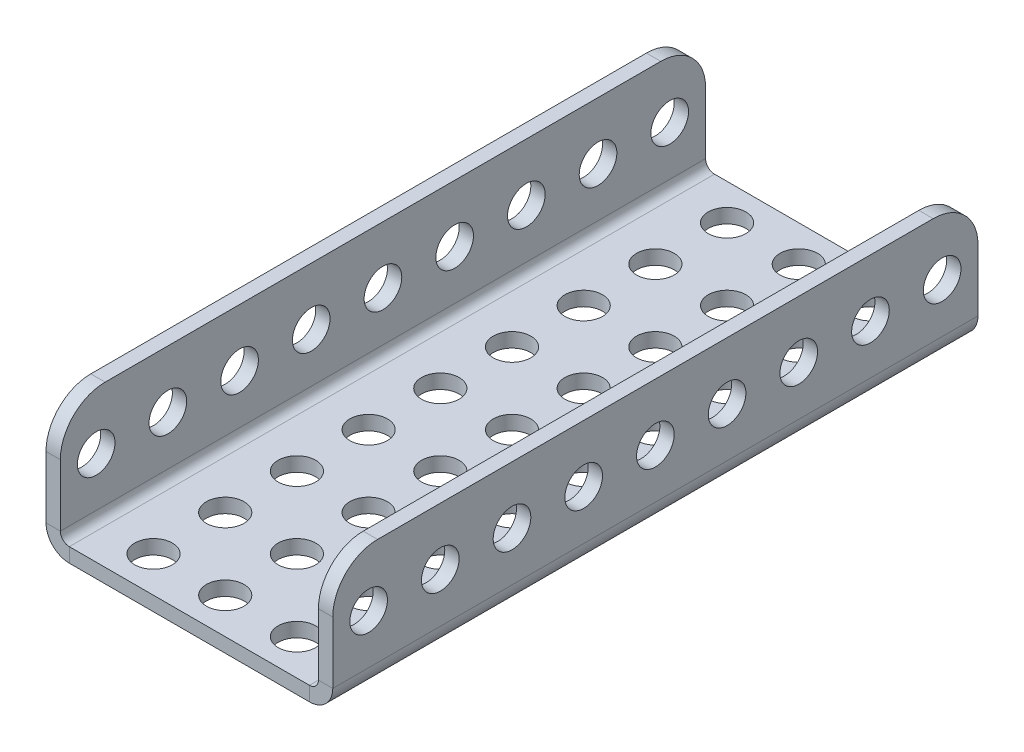
from build123d import *

# Parameters (mm, degrees)
SKETCH1_W                      = 32
SKETCH1_H                      = 72
BOSS_EXTRUDE1_DEPTH            = 1.6
SKETCH2_R                      = 2.1
CUT_EXTRUDE1_DEPTH             = 79.807106279
LPATTERN1_COUNT                = 3
LPATTERN1_PITCH                = 8
LPATTERN1_COUNT_DIR2           = 9
LPATTERN1_PITCH_DIR2           = 8
EDGE_FLANGE1_STRIP_W           = 8.4
EDGE_FLANGE1_STRIP_H           = 1.6
EDGE_FLANGE1_STRIP_CUT_DEPTH   = 72
EDGE_FLANGE1_STRIP_2_W         = 8.4
EDGE_FLANGE1_STRIP_2_H         = 1.6
EDGE_FLANGE1_STRIP_CUT_2_DEPTH = 72
EDGE_FLANGE1_DEPTH             = 72
EDGE_FLANGE1_BEND_DEPTH        = 72
FILLET1_R                      = 5
SKETCH14_R                     = 2.1
CUT_EXTRUDE2_DEPTH             = 81.113981302
LPATTERN2_COUNT                = 9
LPATTERN2_PITCH                = 8


# Sheet-metal steps are written as plain solids
with BuildPart() as part:
    # Sketch1 → Boss-Extrude1 (new body)
    with BuildSketch(Plane(origin=(0, 0, 0), x_dir=(1, 0, 0), z_dir=(0, 1, 0))):
        with Locations((16, -36)):
            Rectangle(SKETCH1_W, SKETCH1_H)
    extrude(amount=BOSS_EXTRUDE1_DEPTH)

    # Sketch2 → Cut-Extrude1 (cut, through all)
    with BuildSketch(Plane(origin=(0, 1.6, 0), x_dir=(1, 0, 0), z_dir=(0, 1, 0))):
        with Locations(Location((8, -4, 0), (0, 0, 270))):
            Circle(SKETCH2_R)
    cut_extrude1 = extrude(amount=-CUT_EXTRUDE1_DEPTH, mode=Mode.SUBTRACT)

    # LPattern1: Cut-Extrude1 3 × 9
    with Locations(*[(i * LPATTERN1_PITCH, 0, j * LPATTERN1_PITCH_DIR2) for i in range(LPATTERN1_COUNT) for j in range(LPATTERN1_COUNT_DIR2) if (i, j) != (0, 0)]):
        add(cut_extrude1, mode=Mode.SUBTRACT)

    # Edge-Flange1 strip (across the edge) → Edge-Flange1 strip cut (cut)
    with BuildSketch(Plane(origin=(32, 1.6, 72), x_dir=(-1, 0, 0), z_dir=(0, 0, -1))):
        with Locations((-1.6, -0.8)):
            Rectangle(EDGE_FLANGE1_STRIP_W, EDGE_FLANGE1_STRIP_H)
    extrude(amount=EDGE_FLANGE1_STRIP_CUT_DEPTH, mode=Mode.SUBTRACT)

    # Edge-Flange1 strip 2 (across the edge) → Edge-Flange1 strip cut 2 (cut)
    with BuildSketch(Plane(origin=(0, 1.6, 0), x_dir=(1, 0, 0), z_dir=(0, 0, 1))):
        with Locations((-1.6, -0.8)):
            Rectangle(EDGE_FLANGE1_STRIP_2_W, EDGE_FLANGE1_STRIP_2_H)
    extrude(amount=EDGE_FLANGE1_STRIP_CUT_2_DEPTH, mode=Mode.SUBTRACT)

    # Edge-Flange1 section (across the edge) → Edge-Flange1 (add)
    with BuildSketch(Plane(origin=(32, 1.6, 72), x_dir=(-1, 0, 0), z_dir=(0, 0, -1))):
        with BuildLine():
            Line((0, 1), (0, 12.9))
            Line((0, 12.9), (1.6, 12.9))
            Line((1.6, 12.9), (1.6, 1))
            ThreePointArc((1.6, 1), (1.892893219, 0.292893219), (2.6, 0))
            Line((2.6, 0), (2.6, -1.6))
            ThreePointArc((2.6, -1.6), (0.761522369, -0.838477631), (0, 1))
        make_face()
    extrude(amount=EDGE_FLANGE1_DEPTH)

    # Edge-Flange1 section 2 (across the edge) → Edge-Flange1 bend (add)
    with BuildSketch(Plane(origin=(0, 1.6, 0), x_dir=(1, 0, 0), z_dir=(0, 0, 1))):
        with BuildLine():
            Line((0, 1), (0, 12.9))
            Line((0, 12.9), (1.6, 12.9))
            Line((1.6, 12.9), (1.6, 1))
            ThreePointArc((1.6, 1), (1.892893219, 0.292893219), (2.6, 0))
            Line((2.6, 0), (2.6, -1.6))
            ThreePointArc((2.6, -1.6), (0.761522369, -0.838477631), (0, 1))
        make_face()
    extrude(amount=EDGE_FLANGE1_BEND_DEPTH)

    # Fillet1
    fillet1_edges = [part.edges().sort_by_distance(p)[0] for p in [
        (31.2, 14.5, 72),
        (31.2, 14.5, 0),
        (0.8, 14.5, 0),
        (0.8, 14.5, 72),
    ]]
    fillet(fillet1_edges, radius=FILLET1_R)

    # Sketch14 → Cut-Extrude2 (cut, through all)
    with BuildSketch(Plane.ZY):
        with Locations(Location((4, 8.1, 0), (0, 0, 270))):
            Circle(SKETCH14_R)
    cut_extrude2 = extrude(amount=-CUT_EXTRUDE2_DEPTH, mode=Mode.SUBTRACT)

    # LPattern2: Cut-Extrude2 ×9
    with Locations(*[(0, 0, i * LPATTERN2_PITCH) for i in range(1, LPATTERN2_COUNT)]):
        add(cut_extrude2, mode=Mode.SUBTRACT)


solid = part.part
